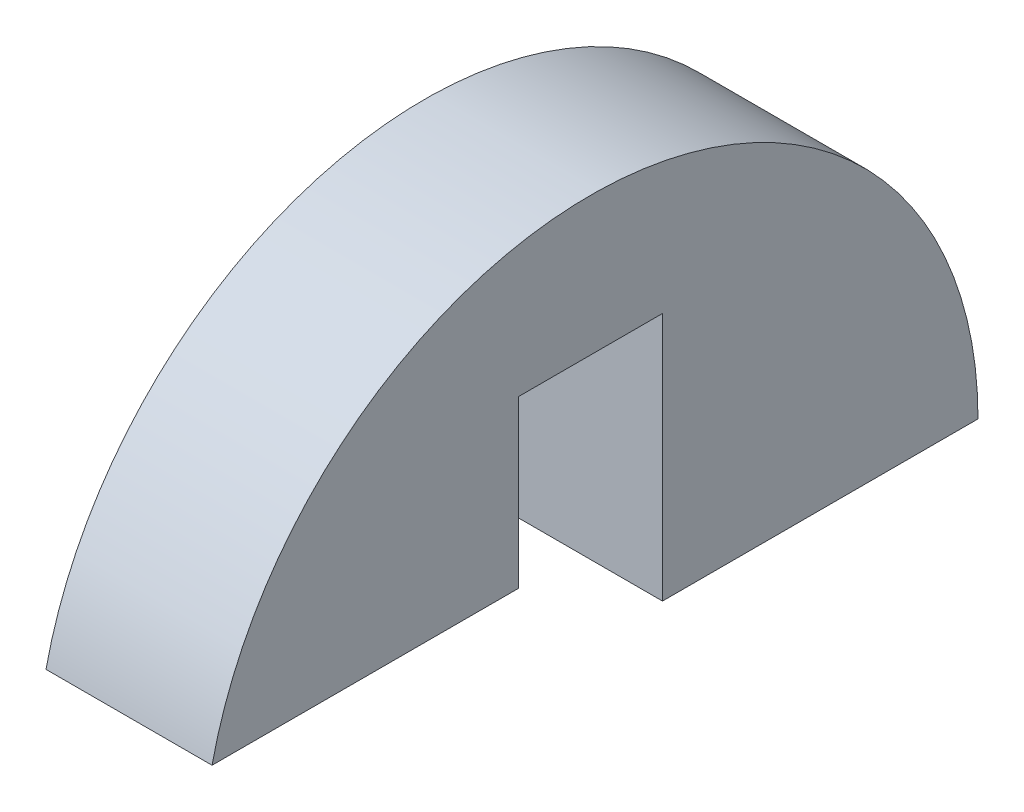
from build123d import *

# Parameters (mm, degrees)
BOSS_EXTRUDE1_DEPTH      = 1.5
BOSS_EXTRUDE1_DEPTH_BACK = 1.5
BODY_MOVE_COPY1_ANGLE    = 90


with BuildPart() as part:
    # Sketch2 → Boss-Extrude1 (new, two sides: drawn at the far end of the back side and taken through both)
    with BuildSketch(Plane(origin=(0, 0, 0), x_dir=(1, 0, 0), z_dir=(0, 1, 0)).offset(-BOSS_EXTRUDE1_DEPTH_BACK)):
        with BuildLine():
            Line((1.5, 1.3), (0, 1.3))
            Line((0, 1.3), (0, 7))
            ThreePointArc((0, 7), (0.754393744, 6.959230567), (1.5, 6.837397166))
            ThreePointArc((1.5, 6.837397166), (7, 0), (1.5, -6.837397166))
            Line((1.5, -6.837397166), (1.5, -1.3))
            Line((1.5, -1.3), (4.5, -1.3))
            Line((4.5, -1.3), (4.5, 1.3))
            Line((4.5, 1.3), (1.5, 1.3))
        make_face()
    extrude(amount=BOSS_EXTRUDE1_DEPTH + BOSS_EXTRUDE1_DEPTH_BACK)


with BuildPart() as part_1:
    # Body-Move/Copy1: moved
    add(part.part.rotate(Axis((0, 0, 0), (0, 0, 1)), BODY_MOVE_COPY1_ANGLE))


solid = part_1.part
